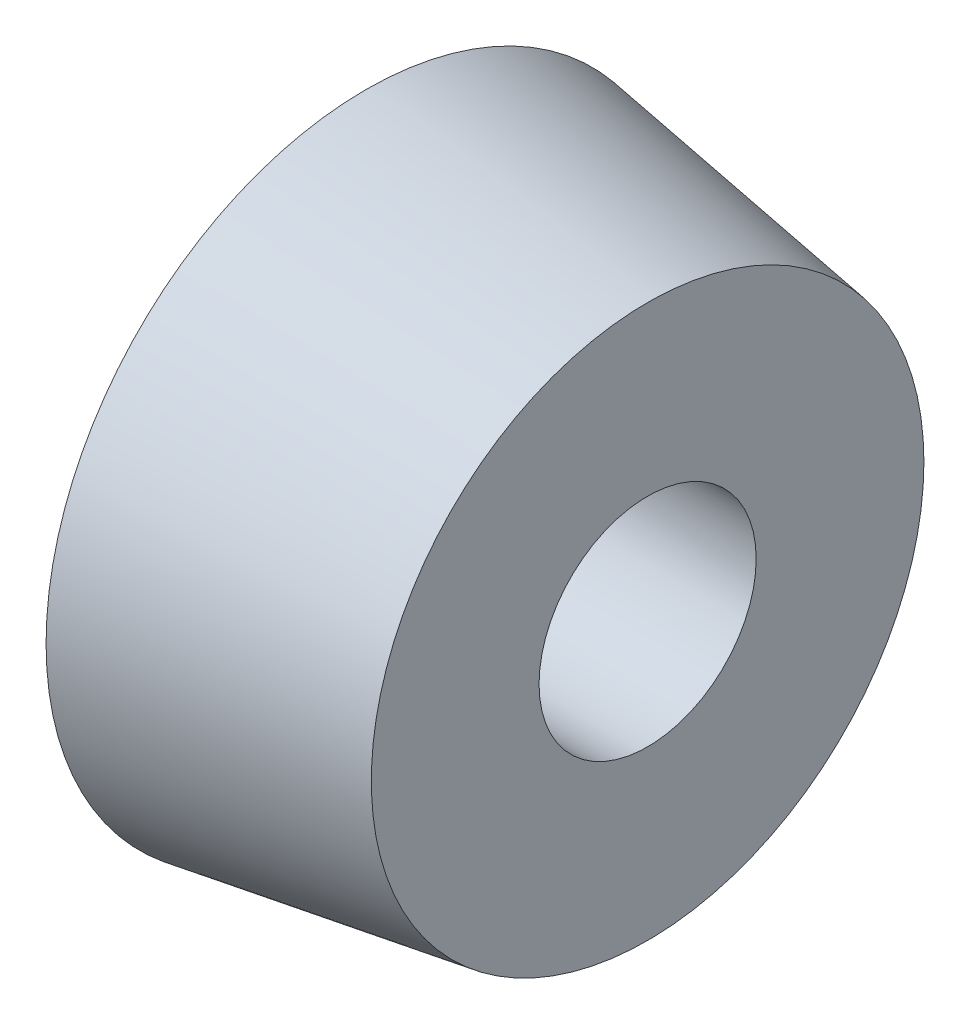
from build123d import *

# Parameters (mm, degrees)
TAP_DRILL_FOR_9_16_HELICOIL0_D = 14.68374


with BuildPart() as part:
    # Sketch1 → Revolve2 (revolve)
    with BuildSketch(Plane(origin=(0, 0, 0), x_dir=(1, 0, 0), z_dir=(0, 1, 0))):
        Polygon((929.772285353, 97.830519041), (929.772285353, 76.2), (948.822285353, 76.2), (948.822285353, 94.885801773), align=None)
    revolve(axis=Axis((1049.721128595, 0, -76.2), (-1, 0, 0)))

    # Tap Drill for 9/16 Helicoil0 (through all)
    with Locations(Plane.ZY.offset(-929.772285353)):
        with Locations((-76.2, 0)):
            Hole(TAP_DRILL_FOR_9_16_HELICOIL0_D / 2)

    # Sketch5 → Cut-Revolve1 (revolve, cut)
    with BuildSketch(Plane(origin=(0, 0, 0), x_dir=(1, 0, 0), z_dir=(0, 1, 0))):
        with BuildLine():
            Line((927.609152682, 95.594725662), (927.609152682, 86.08187))
            Line((927.609152682, 86.08187), (943.107285353, 86.08187))
            ThreePointArc((943.107285353, 86.08187), (945.352349383, 87.01180597), (946.282285353, 89.25687))
            Line((946.282285353, 89.25687), (946.282285353, 89.986341597))
            ThreePointArc((946.282285353, 89.986341597), (945.517739835, 92.052820291), (943.592311059, 93.124075663))
            Line((943.592311059, 93.124075663), (927.609152682, 95.594725662))
        make_face()
    revolve(axis=Axis((1049.721128595, 0, -76.2), (-1, 0, 0)), mode=Mode.SUBTRACT)


solid = part.part
